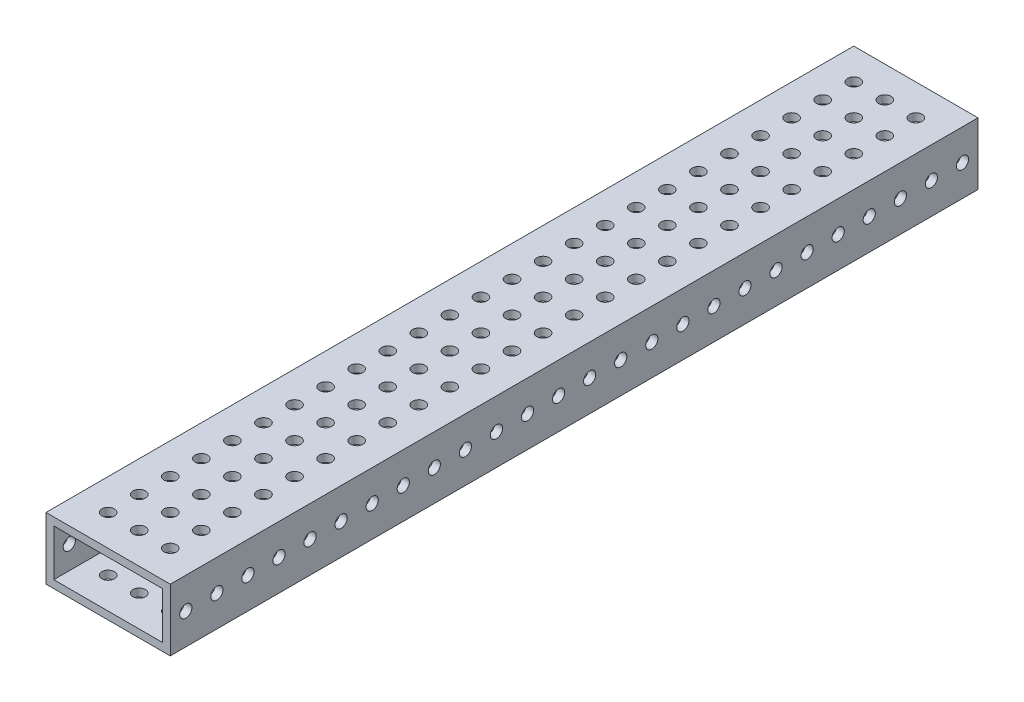
from build123d import *

# Parameters (mm, degrees)
SKETCH1_W           = 50.8
SKETCH1_H           = 25.4
SKETCH1_W_2         = 44.45
SKETCH1_H_2         = 19.05
BOSS_EXTRUDE1_DEPTH = 165.1
SKETCH2_R           = 2.5527
CUT_EXTRUDE1_DEPTH  = 169.962510635
SKETCH4_R           = 2.4892
CUT_EXTRUDE3_DEPTH  = 174.204907552


with BuildPart() as part:
    # Sketch1 → Boss-Extrude1 (new, symmetric)
    with BuildSketch(Plane.XY):
        Rectangle(SKETCH1_W, SKETCH1_H)
        Rectangle(SKETCH1_W_2, SKETCH1_H_2, mode=Mode.SUBTRACT)
    extrude(amount=BOSS_EXTRUDE1_DEPTH, both=True)

    # Sketch2 → Cut-Extrude1 (cut, through all)
    with BuildSketch(Plane(origin=(0, 12.7, 0), x_dir=(1, 0, 0), z_dir=(0, 1, 0))):
        with Locations((0, -152.4)):
            Circle(SKETCH2_R)
        with Locations((12.7, -152.4)):
            Circle(SKETCH2_R)
        with Locations((-12.7, -152.4)):
            Circle(SKETCH2_R)
        with Locations((-12.7, -139.7)):
            Circle(SKETCH2_R)
        with Locations((0, -139.7)):
            Circle(SKETCH2_R)
        with Locations((12.7, -139.7)):
            Circle(SKETCH2_R)
        with Locations((-12.7, -127)):
            Circle(SKETCH2_R)
        with Locations((0, -127)):
            Circle(SKETCH2_R)
        with Locations((12.7, -127)):
            Circle(SKETCH2_R)
        with Locations((-12.7, -114.3)):
            Circle(SKETCH2_R)
        with Locations((0, -114.3)):
            Circle(SKETCH2_R)
        with Locations((12.7, -114.3)):
            Circle(SKETCH2_R)
        with Locations((-12.7, -101.6)):
            Circle(SKETCH2_R)
        with Locations((0, -101.6)):
            Circle(SKETCH2_R)
        with Locations((12.7, -101.6)):
            Circle(SKETCH2_R)
        with Locations((-12.7, -88.9)):
            Circle(SKETCH2_R)
        with Locations((0, -88.9)):
            Circle(SKETCH2_R)
        with Locations((12.7, -88.9)):
            Circle(SKETCH2_R)
        with Locations((-12.7, -76.2)):
            Circle(SKETCH2_R)
        with Locations((0, -76.2)):
            Circle(SKETCH2_R)
        with Locations((12.7, -76.2)):
            Circle(SKETCH2_R)
        with Locations((-12.7, -63.5)):
            Circle(SKETCH2_R)
        with Locations((0, -63.5)):
            Circle(SKETCH2_R)
        with Locations((12.7, -63.5)):
            Circle(SKETCH2_R)
        with Locations((-12.7, -50.8)):
            Circle(SKETCH2_R)
        with Locations((0, -50.8)):
            Circle(SKETCH2_R)
        with Locations((12.7, -50.8)):
            Circle(SKETCH2_R)
        with Locations((-12.7, -38.1)):
            Circle(SKETCH2_R)
        with Locations((0, -38.1)):
            Circle(SKETCH2_R)
        with Locations((12.7, -38.1)):
            Circle(SKETCH2_R)
        with Locations((-12.7, -25.4)):
            Circle(SKETCH2_R)
        with Locations((0, -25.4)):
            Circle(SKETCH2_R)
        with Locations((12.7, -25.4)):
            Circle(SKETCH2_R)
        with Locations((-12.7, -12.7)):
            Circle(SKETCH2_R)
        with Locations((0, -12.7)):
            Circle(SKETCH2_R)
        with Locations((12.7, -12.7)):
            Circle(SKETCH2_R)
        with Locations((-12.7, 0)):
            Circle(SKETCH2_R)
        Circle(SKETCH2_R)
        with Locations((12.7, 0)):
            Circle(SKETCH2_R)
        with Locations((-12.7, 12.7)):
            Circle(SKETCH2_R)
        with Locations((0, 12.7)):
            Circle(SKETCH2_R)
        with Locations((12.7, 12.7)):
            Circle(SKETCH2_R)
        with Locations((-12.7, 25.4)):
            Circle(SKETCH2_R)
        with Locations((0, 25.4)):
            Circle(SKETCH2_R)
        with Locations((12.7, 25.4)):
            Circle(SKETCH2_R)
        with Locations((-12.7, 38.1)):
            Circle(SKETCH2_R)
        with Locations((0, 38.1)):
            Circle(SKETCH2_R)
        with Locations((12.7, 38.1)):
            Circle(SKETCH2_R)
        with Locations((-12.7, 50.8)):
            Circle(SKETCH2_R)
        with Locations((0, 50.8)):
            Circle(SKETCH2_R)
        with Locations((12.7, 50.8)):
            Circle(SKETCH2_R)
        with Locations((-12.7, 63.5)):
            Circle(SKETCH2_R)
        with Locations((0, 63.5)):
            Circle(SKETCH2_R)
        with Locations((12.7, 63.5)):
            Circle(SKETCH2_R)
        with Locations((-12.7, 76.2)):
            Circle(SKETCH2_R)
        with Locations((0, 76.2)):
            Circle(SKETCH2_R)
        with Locations((12.7, 76.2)):
            Circle(SKETCH2_R)
        with Locations((-12.7, 88.9)):
            Circle(SKETCH2_R)
        with Locations((0, 88.9)):
            Circle(SKETCH2_R)
        with Locations((12.7, 88.9)):
            Circle(SKETCH2_R)
        with Locations((-12.7, 101.6)):
            Circle(SKETCH2_R)
        with Locations((0, 101.6)):
            Circle(SKETCH2_R)
        with Locations((12.7, 101.6)):
            Circle(SKETCH2_R)
        with Locations((-12.7, 114.3)):
            Circle(SKETCH2_R)
        with Locations((0, 114.3)):
            Circle(SKETCH2_R)
        with Locations((12.7, 114.3)):
            Circle(SKETCH2_R)
        with Locations((-12.7, 127)):
            Circle(SKETCH2_R)
        with Locations((0, 127)):
            Circle(SKETCH2_R)
        with Locations((12.7, 127)):
            Circle(SKETCH2_R)
        with Locations((-12.7, 139.7)):
            Circle(SKETCH2_R)
        with Locations((0, 139.7)):
            Circle(SKETCH2_R)
        with Locations((12.7, 139.7)):
            Circle(SKETCH2_R)
        with Locations((-12.7, 152.4)):
            Circle(SKETCH2_R)
        with Locations((0, 152.4)):
            Circle(SKETCH2_R)
        with Locations((12.7, 152.4)):
            Circle(SKETCH2_R)
        with Locations((-12.7, 177.8)):
            Circle(SKETCH2_R)
        with Locations((0, 177.8)):
            Circle(SKETCH2_R)
        with Locations((12.7, 177.8)):
            Circle(SKETCH2_R)
        with Locations((-12.7, 190.5)):
            Circle(SKETCH2_R)
        with Locations((0, 190.5)):
            Circle(SKETCH2_R)
        with Locations((12.7, 190.5)):
            Circle(SKETCH2_R)
        with Locations((-12.7, 203.2)):
            Circle(SKETCH2_R)
        with Locations((0, 203.2)):
            Circle(SKETCH2_R)
        with Locations((12.7, 203.2)):
            Circle(SKETCH2_R)
        with Locations((-12.7, 215.9)):
            Circle(SKETCH2_R)
        with Locations((0, 215.9)):
            Circle(SKETCH2_R)
        with Locations((12.7, 215.9)):
            Circle(SKETCH2_R)
        with Locations((-12.7, 228.6)):
            Circle(SKETCH2_R)
        with Locations((0, 228.6)):
            Circle(SKETCH2_R)
        with Locations((12.7, 228.6)):
            Circle(SKETCH2_R)
        with Locations((-12.7, 241.3)):
            Circle(SKETCH2_R)
        with Locations((0, 241.3)):
            Circle(SKETCH2_R)
        with Locations((12.7, 241.3)):
            Circle(SKETCH2_R)
        with Locations((-12.7, 254)):
            Circle(SKETCH2_R)
        with Locations((0, 254)):
            Circle(SKETCH2_R)
        with Locations((12.7, 254)):
            Circle(SKETCH2_R)
        with Locations((-12.7, 266.7)):
            Circle(SKETCH2_R)
        with Locations((0, 266.7)):
            Circle(SKETCH2_R)
        with Locations((12.7, 266.7)):
            Circle(SKETCH2_R)
        with Locations((12.7, 279.4)):
            Circle(SKETCH2_R)
        with Locations((0, 279.4)):
            Circle(SKETCH2_R)
        with Locations((-12.7, 279.4)):
            Circle(SKETCH2_R)
        with Locations((12.7, 292.1)):
            Circle(SKETCH2_R)
        with Locations((0, 292.1)):
            Circle(SKETCH2_R)
        with Locations((-12.7, 292.1)):
            Circle(SKETCH2_R)
        with Locations((12.7, 304.8)):
            Circle(SKETCH2_R)
        with Locations((0, 304.8)):
            Circle(SKETCH2_R)
        with Locations((-12.7, 304.8)):
            Circle(SKETCH2_R)
        with Locations((12.7, 317.5)):
            Circle(SKETCH2_R)
        with Locations((0, 317.5)):
            Circle(SKETCH2_R)
        with Locations((-12.7, 317.5)):
            Circle(SKETCH2_R)
        with Locations((12.7, 330.2)):
            Circle(SKETCH2_R)
        with Locations((0, 330.2)):
            Circle(SKETCH2_R)
        with Locations((-12.7, 330.2)):
            Circle(SKETCH2_R)
        with Locations((12.7, 342.9)):
            Circle(SKETCH2_R)
        with Locations((0, 342.9)):
            Circle(SKETCH2_R)
        with Locations((-12.7, 342.9)):
            Circle(SKETCH2_R)
        with Locations((12.7, 355.6)):
            Circle(SKETCH2_R)
        with Locations((0, 355.6)):
            Circle(SKETCH2_R)
        with Locations((-12.7, 355.6)):
            Circle(SKETCH2_R)
        with Locations((12.7, 368.3)):
            Circle(SKETCH2_R)
        with Locations((0, 368.3)):
            Circle(SKETCH2_R)
        with Locations((-12.7, 368.3)):
            Circle(SKETCH2_R)
        with Locations((12.7, 381)):
            Circle(SKETCH2_R)
        with Locations((0, 381)):
            Circle(SKETCH2_R)
        with Locations((-12.7, 381)):
            Circle(SKETCH2_R)
        with Locations((12.7, 393.7)):
            Circle(SKETCH2_R)
        with Locations((0, 393.7)):
            Circle(SKETCH2_R)
        with Locations((-12.7, 393.7)):
            Circle(SKETCH2_R)
        with Locations((12.7, 406.4)):
            Circle(SKETCH2_R)
        with Locations((0, 406.4)):
            Circle(SKETCH2_R)
        with Locations((-12.7, 406.4)):
            Circle(SKETCH2_R)
        with Locations((12.7, 419.1)):
            Circle(SKETCH2_R)
        with Locations((0, 419.1)):
            Circle(SKETCH2_R)
        with Locations((-12.7, 419.1)):
            Circle(SKETCH2_R)
        with Locations((12.7, 431.8)):
            Circle(SKETCH2_R)
        with Locations((0, 431.8)):
            Circle(SKETCH2_R)
        with Locations((-12.7, 431.8)):
            Circle(SKETCH2_R)
    extrude(amount=-CUT_EXTRUDE1_DEPTH, mode=Mode.SUBTRACT)

    # Sketch4 → Cut-Extrude3 (cut, through all)
    with BuildSketch(Plane(origin=(25.4, 0, 0), x_dir=(0, 0, -1), z_dir=(1, 0, 0))):
        with Locations((-158.75, 0)):
            Circle(SKETCH4_R)
        with Locations((-146.05, 0)):
            Circle(SKETCH4_R)
        with Locations((-133.35, 0)):
            Circle(SKETCH4_R)
        with Locations((-120.65, 0)):
            Circle(SKETCH4_R)
        with Locations((-107.95, 0)):
            Circle(SKETCH4_R)
        with Locations((273.05, 0)):
            Circle(SKETCH4_R)
        with Locations((285.75, 0)):
            Circle(SKETCH4_R)
        with Locations((298.45, 0)):
            Circle(SKETCH4_R)
        with Locations((311.15, 0)):
            Circle(SKETCH4_R)
        with Locations((323.85, 0)):
            Circle(SKETCH4_R)
        with Locations((336.55, 0)):
            Circle(SKETCH4_R)
        with Locations((349.25, 0)):
            Circle(SKETCH4_R)
        with Locations((361.95, 0)):
            Circle(SKETCH4_R)
        with Locations((374.65, 0)):
            Circle(SKETCH4_R)
        with Locations((387.35, 0)):
            Circle(SKETCH4_R)
        with Locations((400.05, 0)):
            Circle(SKETCH4_R)
        with Locations((412.75, 0)):
            Circle(SKETCH4_R)
        with Locations((425.45, 0)):
            Circle(SKETCH4_R)
        with Locations((438.15, 0)):
            Circle(SKETCH4_R)
        with Locations((-95.25, 0)):
            Circle(SKETCH4_R)
        with Locations((-82.55, 0)):
            Circle(SKETCH4_R)
        with Locations((-69.85, 0)):
            Circle(SKETCH4_R)
        with Locations((-57.15, 0)):
            Circle(SKETCH4_R)
        with Locations((-44.45, 0)):
            Circle(SKETCH4_R)
        with Locations((-31.75, 0)):
            Circle(SKETCH4_R)
        with Locations((-19.05, 0)):
            Circle(SKETCH4_R)
        with Locations((-6.35, 0)):
            Circle(SKETCH4_R)
        with Locations((6.35, 0)):
            Circle(SKETCH4_R)
        with Locations((19.05, 0)):
            Circle(SKETCH4_R)
        with Locations((31.75, 0)):
            Circle(SKETCH4_R)
        with Locations((44.45, 0)):
            Circle(SKETCH4_R)
        with Locations((57.15, 0)):
            Circle(SKETCH4_R)
        with Locations((69.85, 0)):
            Circle(SKETCH4_R)
        with Locations((82.55, 0)):
            Circle(SKETCH4_R)
        with Locations((95.25, 0)):
            Circle(SKETCH4_R)
        with Locations((107.95, 0)):
            Circle(SKETCH4_R)
        with Locations((120.65, 0)):
            Circle(SKETCH4_R)
        with Locations((133.35, 0)):
            Circle(SKETCH4_R)
        with Locations((146.05, 0)):
            Circle(SKETCH4_R)
        with Locations((158.75, 0)):
            Circle(SKETCH4_R)
        with Locations((171.45, 0)):
            Circle(SKETCH4_R)
        with Locations((184.15, 0)):
            Circle(SKETCH4_R)
        with Locations((196.85, 0)):
            Circle(SKETCH4_R)
        with Locations((209.55, 0)):
            Circle(SKETCH4_R)
        with Locations((222.25, 0)):
            Circle(SKETCH4_R)
        with Locations((234.95, 0)):
            Circle(SKETCH4_R)
        with Locations((247.65, 0)):
            Circle(SKETCH4_R)
        with Locations((260.35, 0)):
            Circle(SKETCH4_R)
    extrude(amount=-CUT_EXTRUDE3_DEPTH, mode=Mode.SUBTRACT)


solid = part.part
